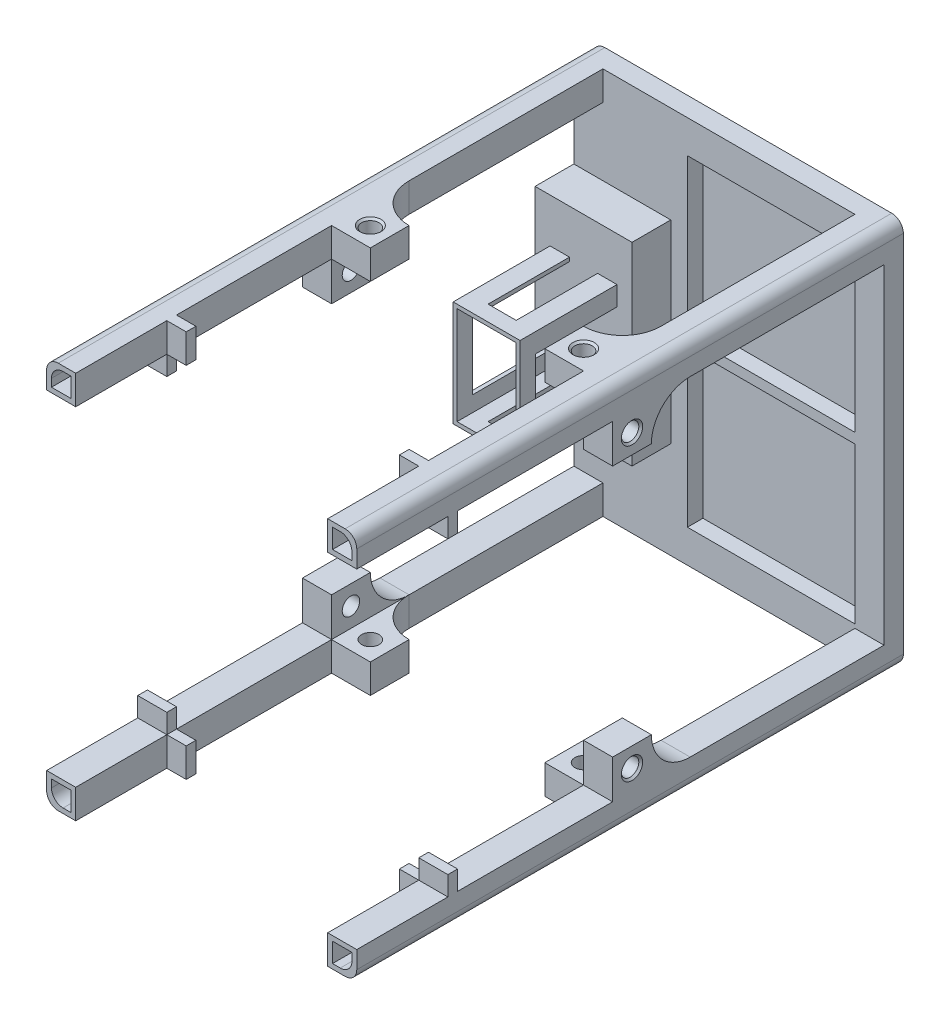
from build123d import *

# Parameters (mm, degrees)
ESQUISSE1_W             = 80
ESQUISSE1_H             = 100
BOSS_EXTRU_1_DEPTH      = 5
ESQUISSE4_W             = 7.5
ESQUISSE4_H             = 7.5
BOSS_EXTRU_3_DEPTH      = 136
ESQUISSE22_W            = 7.5
ESQUISSE22_H            = 10
BOSS_EXTRU_4_DEPTH      = 10
ESQUISSE27_W            = 7.5
ESQUISSE27_H            = 10
BOSS_EXTRU_5_DEPTH      = 10
ESQUISSE28_W            = 10
ESQUISSE28_H            = 7.5
BOSS_EXTRU_6_DEPTH      = 10
ESQUISSE29_W            = 10
ESQUISSE29_H            = 7.5
BOSS_EXTRU_7_DEPTH      = 10
ESQUISSE31_W            = 43.2
ESQUISSE31_H            = 40.2
ENL_V_MAT_EXTRU_4_DEPTH = 4
ESQUISSE32_R            = 2.25
ENL_V_MAT_EXTRU_5_DEPTH = 191.475720238
ESQUISSE33_R            = 2.25
ENL_V_MAT_EXTRU_6_DEPTH = 191.475720238
CHANFREIN1_SIZE         = 0.5
CONG_1_R                = 10
CONG_2_R                = 10
ESQUISSE37_W            = 25
ESQUISSE37_H            = 50
BOSS_EXTRU_8_DEPTH      = 10
CONG_3_R                = 3
ESQUISSE42_R            = 1.11
ENL_V_MAT_EXTRU_7_DEPTH = 14.5
ESQUISSE43_W            = 7.5
ESQUISSE43_H            = 2.5
BOSS_EXTRU_9_DEPTH      = 5
ESQUISSE44_W            = 7.5
ESQUISSE44_H            = 2.5
BOSS_EXTRU_10_DEPTH     = 5
ESQUISSE45_W            = 2.5
ESQUISSE45_H            = 7.5
BOSS_EXTRU_11_DEPTH     = 5
ESQUISSE46_W            = 2.5
ESQUISSE46_H            = 7.5
BOSS_EXTRU_12_DEPTH     = 5
ESQUISSE47_W            = 15.25
ESQUISSE47_H            = 25.25
BOSS_EXTRU_13_DEPTH     = 25
ESQUISSE48_W            = 21
ESQUISSE48_H            = 17.25
ENL_V_MAT_EXTRU_8_DEPTH = 189.880956226
ESQUISSE50_W            = 7.25
ESQUISSE50_H            = 21
ENL_V_MAT_EXTRU_9_DEPTH = 35


# Some blends are built 0.0001 mm under size
with BuildPart() as part:
    # Esquisse1 → Boss.-Extru.1 (new body)
    with BuildSketch(Plane.XY):
        with Locations((-40, -50)):
            Rectangle(ESQUISSE1_W, ESQUISSE1_H)
    extrude(amount=BOSS_EXTRU_1_DEPTH)

    # Esquisse4 → Boss.-Extru.3 (add)
    # profile 1 of 4: a face of its own
    with BuildSketch(Plane.XY.offset(5)):
        with Locations((-76.25, -3.75)):
            Rectangle(ESQUISSE4_W, ESQUISSE4_H)
        with BuildLine():
            Line((-73.75, -6.25), (-78.75, -6.25))
            Line((-78.75, -6.25), (-78.75, -4.25))
            ThreePointArc((-78.75, -4.25), (-77.871320344, -2.128679656), (-75.75, -1.25))
            Line((-75.75, -1.25), (-73.75, -1.25))
            Line((-73.75, -1.25), (-73.75, -6.25))
        make_face(mode=Mode.SUBTRACT)
    # profile 2 of 4: a face of its own
    with BuildSketch(Plane.XY.offset(5)):
        with Locations((-3.75, -3.75)):
            Rectangle(ESQUISSE4_W, ESQUISSE4_H)
        with BuildLine():
            Line((-1.25, -6.25), (-1.25, -4.25))
            ThreePointArc((-1.25, -4.25), (-2.128679656, -2.128679656), (-4.25, -1.25))
            Line((-4.25, -1.25), (-6.25, -1.25))
            Line((-6.25, -1.25), (-6.25, -6.25))
            Line((-6.25, -6.25), (-1.25, -6.25))
        make_face(mode=Mode.SUBTRACT)
    # profile 3 of 4: a face of its own
    with BuildSketch(Plane.XY.offset(5)):
        with Locations((-3.75, -96.25)):
            Rectangle(ESQUISSE4_W, ESQUISSE4_H)
        with BuildLine():
            Line((-6.25, -93.75), (-1.25, -93.75))
            Line((-1.25, -93.75), (-1.25, -95.75))
            ThreePointArc((-1.25, -95.75), (-2.128679656, -97.871320344), (-4.25, -98.75))
            Line((-4.25, -98.75), (-6.25, -98.75))
            Line((-6.25, -98.75), (-6.25, -93.75))
        make_face(mode=Mode.SUBTRACT)
    # profile 4 of 4: a face of its own
    with BuildSketch(Plane.XY.offset(5)):
        with Locations((-76.25, -96.25)):
            Rectangle(ESQUISSE4_W, ESQUISSE4_H)
        with BuildLine():
            Line((-78.75, -93.75), (-78.75, -95.75))
            ThreePointArc((-78.75, -95.75), (-77.871320344, -97.871320344), (-75.75, -98.75))
            Line((-75.75, -98.75), (-73.75, -98.75))
            Line((-73.75, -98.75), (-73.75, -93.75))
            Line((-73.75, -93.75), (-78.75, -93.75))
        make_face(mode=Mode.SUBTRACT)
    extrude(amount=BOSS_EXTRU_3_DEPTH)

    # Esquisse22 → Boss.-Extru.4 (add)
    with BuildSketch(Plane.XZ.offset(7.5)):
        with Locations((-76.25, 70)):
            Rectangle(ESQUISSE22_W, ESQUISSE22_H)
        with Locations((-3.75, 70)):
            Rectangle(ESQUISSE22_W, ESQUISSE22_H)
    extrude(amount=BOSS_EXTRU_4_DEPTH)

    # Esquisse27 → Boss.-Extru.5 (add)
    with BuildSketch(Plane(origin=(0, -92.5, 0), x_dir=(1, 0, 0), z_dir=(0, 1, 0))):
        with Locations((-3.75, -70)):
            Rectangle(ESQUISSE27_W, ESQUISSE27_H)
        with Locations((-76.25, -70)):
            Rectangle(ESQUISSE27_W, ESQUISSE27_H)
    extrude(amount=BOSS_EXTRU_5_DEPTH)

    # Esquisse28 → Boss.-Extru.6 (add)
    with BuildSketch(Plane(origin=(-72.5, 0, 0), x_dir=(0, 0, -1), z_dir=(1, 0, 0))):
        with Locations((-70, -3.75)):
            Rectangle(ESQUISSE28_W, ESQUISSE28_H)
        with Locations((-70, -96.25)):
            Rectangle(ESQUISSE28_W, ESQUISSE28_H)
    extrude(amount=BOSS_EXTRU_6_DEPTH)

    # Esquisse29 → Boss.-Extru.7 (add)
    with BuildSketch(Plane.ZY.offset(7.5)):
        with Locations((70, -96.25)):
            Rectangle(ESQUISSE29_W, ESQUISSE29_H)
        with Locations((70, -3.75)):
            Rectangle(ESQUISSE29_W, ESQUISSE29_H)
    extrude(amount=BOSS_EXTRU_7_DEPTH)

    # Esquisse31 → Enlèv. mat.-Extru.4 (cut)
    with BuildSketch(Plane.XY.offset(5)):
        with Locations((-29.1, -71.4)):
            Rectangle(ESQUISSE31_W, ESQUISSE31_H)
        with Locations((-29.1, -28.6)):
            Rectangle(ESQUISSE31_W, ESQUISSE31_H)
    extrude(amount=-ENL_V_MAT_EXTRU_4_DEPTH, mode=Mode.SUBTRACT)

    # Esquisse32 → Enlèv. mat.-Extru.5 (cut, through all)
    with BuildSketch(Plane(origin=(0, 0, 0), x_dir=(0, 0, -1), z_dir=(1, 0, 0))):
        with Locations(Location((-70, -12.5, 0), (0, 0, 90))):
            Circle(ESQUISSE32_R)
        with Locations(Location((-70, -87.5, 0), (0, 0, 180))):
            Circle(ESQUISSE32_R)
    extrude(amount=-ENL_V_MAT_EXTRU_5_DEPTH, mode=Mode.SUBTRACT)

    # Esquisse33 → Enlèv. mat.-Extru.6 (cut, through all)
    with BuildSketch(Plane.XZ.offset(100)):
        with Locations((-67.5, 70)):
            Circle(ESQUISSE33_R)
        with Locations(Location((-12.5, 70, 0), (0, 0, 90))):
            Circle(ESQUISSE33_R)
    extrude(amount=-ENL_V_MAT_EXTRU_6_DEPTH, mode=Mode.SUBTRACT)

    # Chanfrein1
    chanfrein1_edges = [part.edges().sort_by_distance(p)[0] for p in [
        (-80, -14.75, 70),
        (0, -14.75, 70),
        (-80, -87.5, 67.75),
        (0, -87.5, 67.75),
        (-69.75, 0, 70),
        (-69.75, -100, 70),
        (-12.5, 0, 67.75),
        (-12.5, -100, 67.75),
    ]]
    chamfer(chanfrein1_edges, length=CHANFREIN1_SIZE)

    # Congé1
    # the kernel refuses this fillet: 10 mm, written as the material it adds along each edge
    with BuildSketch(Plane(origin=(-7.5, -7.5, 65), x_dir=(-1, 0, 0), z_dir=(0, 1, 0)), Plane(origin=(-7.5, -92.5, 65), x_dir=(0, 0, -1), z_dir=(0, -1, 0))) as cong_1_piece_1:
        with BuildLine():
            CenterArc((CONG_1_R, -CONG_1_R), CONG_1_R, 90, 90)
            Line((0, -CONG_1_R), (0, 0))
            Line((0, 0), (CONG_1_R, 0))
        make_face()
    extrude(amount=7.5)
    with BuildSketch(Plane(origin=(-72.5, -7.5, 65), x_dir=(1, 0, 0), z_dir=(0, 1, 0)), Plane(origin=(-72.5, -92.5, 65), x_dir=(0, 0, -1), z_dir=(0, -1, 0))) as cong_1_piece_2:
        with BuildLine():
            CenterArc((CONG_1_R, CONG_1_R), CONG_1_R, 180, 90)
            Line((0, CONG_1_R), (0, 0))
            Line((0, 0), (CONG_1_R, 0))
        make_face()
    extrude(amount=7.5)

    # Congé2
    cong_2_edges = [part.edges().sort_by_distance(p)[0] for p in [
        (-76.25, -7.5, 65),
        (-3.75, -92.5, 65),
        (-3.75, -7.5, 65),
        (-76.25, -92.5, 65),
    ]]
    fillet(cong_2_edges, radius=CONG_2_R - 0.0001)  # a hair under: the kernel refuses the full size

    # Esquisse37 → Boss.-Extru.8 (add)
    with BuildSketch(Plane.XY.offset(5)):
        with Locations((-67.5, -50)):
            Rectangle(ESQUISSE37_W, ESQUISSE37_H)
    extrude(amount=BOSS_EXTRU_8_DEPTH)

    # Congé3
    cong_3_edges = [part.edges().sort_by_distance(p)[0] for p in [
        (0, -100, 70.5),
        (-80, -100, 70.5),
        (-80, 0, 70.5),
        (0, 0, 70.5),
    ]]
    fillet(cong_3_edges, radius=CONG_3_R)

    # Esquisse42 → Enlèv. mat.-Extru.7 (cut)
    with BuildSketch(Plane(origin=(0, 0, 0), x_dir=(-1, 0, 0), z_dir=(0, 0, -1))):
        with Locations((67.5, -43.25)):
            Circle(ESQUISSE42_R)
        with Locations((67.5, -56.75)):
            Circle(ESQUISSE42_R)
    extrude(amount=-ENL_V_MAT_EXTRU_7_DEPTH, mode=Mode.SUBTRACT)

    # Esquisse43 → Boss.-Extru.9 (add)
    with BuildSketch(Plane.XZ.offset(7.5)):
        with Locations((-76.25, 116.25)):
            Rectangle(ESQUISSE43_W, ESQUISSE43_H)
        with Locations((-3.75, 116.25)):
            Rectangle(ESQUISSE43_W, ESQUISSE43_H)
    extrude(amount=BOSS_EXTRU_9_DEPTH)

    # Esquisse44 → Boss.-Extru.10 (add)
    with BuildSketch(Plane(origin=(0, -92.5, 0), x_dir=(1, 0, 0), z_dir=(0, 1, 0))):
        with Locations((-76.25, -116.25)):
            Rectangle(ESQUISSE44_W, ESQUISSE44_H)
        with Locations((-3.75, -116.25)):
            Rectangle(ESQUISSE44_W, ESQUISSE44_H)
    extrude(amount=BOSS_EXTRU_10_DEPTH)

    # Esquisse45 → Boss.-Extru.11 (add)
    with BuildSketch(Plane(origin=(-72.5, 0, 0), x_dir=(0, 0, -1), z_dir=(1, 0, 0))):
        with Locations((-116.25, -3.75)):
            Rectangle(ESQUISSE45_W, ESQUISSE45_H)
        with Locations((-116.25, -96.25)):
            Rectangle(ESQUISSE45_W, ESQUISSE45_H)
    extrude(amount=BOSS_EXTRU_11_DEPTH)

    # Esquisse46 → Boss.-Extru.12 (add)
    with BuildSketch(Plane.ZY.offset(7.5)):
        with Locations((116.25, -3.75)):
            Rectangle(ESQUISSE46_W, ESQUISSE46_H)
        with Locations((116.25, -96.25)):
            Rectangle(ESQUISSE46_W, ESQUISSE46_H)
    extrude(amount=BOSS_EXTRU_12_DEPTH)

    # Esquisse47 → Boss.-Extru.13 (add)
    with BuildSketch(Plane.XY.offset(15)):
        Polygon((-75.886515757, -36.375), (-58.875, -36.375), (-58.875, -63.625), (-76.125, -63.625), (-76.125, -36.375), align=None)
        with Locations((-67.5, -50)):
            Rectangle(ESQUISSE47_W, ESQUISSE47_H, mode=Mode.SUBTRACT)
    extrude(amount=BOSS_EXTRU_13_DEPTH)

    # Esquisse48 → Enlèv. mat.-Extru.8 (cut, through all)
    with BuildSketch(Plane.ZY.offset(76.125)):
        with Locations((25.5, -50)):
            Rectangle(ESQUISSE48_W, ESQUISSE48_H)
    extrude(amount=-ENL_V_MAT_EXTRU_8_DEPTH, mode=Mode.SUBTRACT)

    # Esquisse50 → Enlèv. mat.-Extru.9 (cut)
    with BuildSketch(Plane(origin=(0, -36.375, 0), x_dir=(1, 0, 0), z_dir=(0, 1, 0))):
        with Locations((-67.5, -25.5)):
            Rectangle(ESQUISSE50_W, ESQUISSE50_H)
    extrude(amount=-ENL_V_MAT_EXTRU_9_DEPTH, mode=Mode.SUBTRACT)


solid = part.part
